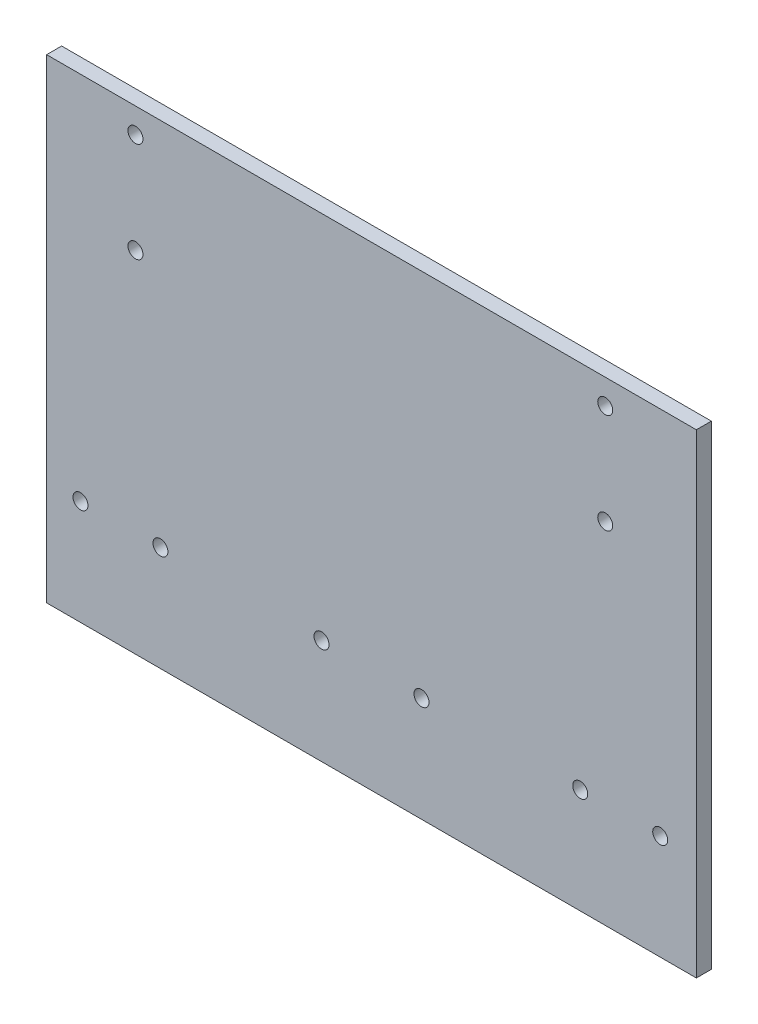
from build123d import *

# Parameters (mm, degrees)
SKETCH_1_W          = 130
SKETCH_1_H          = 95
EXTRUDE_1_DEPTH     = 3
SKETCH_2_R          = 1.5
CUT_EXTRUDE_1_DEPTH = 10
SKETCH_3_R          = 1.5
CUT_EXTRUDE_2_DEPTH = 10
SKETCH_4_R          = 1.5
CUT_EXTRUDE_3_DEPTH = 10


with BuildPart() as part:
    # 草图1 → 凸台-拉伸1 (new body)
    with BuildSketch(Plane.XY):
        Rectangle(SKETCH_1_W, SKETCH_1_H)
    extrude(amount=EXTRUDE_1_DEPTH)

    # 草图2 → 切除-拉伸1 (cut)
    with BuildSketch(Plane.XY.offset(3)):
        with Locations((10, -26.5)):
            Circle(SKETCH_2_R)
        with Locations((-10, -26.5)):
            Circle(SKETCH_2_R)
    extrude(amount=-CUT_EXTRUDE_1_DEPTH, mode=Mode.SUBTRACT)

    # 草图3 → 切除-拉伸2 (cut)
    with BuildSketch(Plane(origin=(0, 0, 0), x_dir=(-1, 0, 0), z_dir=(0, 0, -1))):
        with Locations((-57.767112616, -26.5)):
            Circle(SKETCH_3_R)
        with Locations((-41.767112616, -26.5)):
            Circle(SKETCH_3_R)
        with Locations((42.232887384, -26.5)):
            Circle(SKETCH_3_R)
        with Locations((58.232887384, -26.5)):
            Circle(SKETCH_3_R)
    extrude(amount=-CUT_EXTRUDE_2_DEPTH, mode=Mode.SUBTRACT)

    # 草图4 → 切除-拉伸3 (cut)
    with BuildSketch(Plane(origin=(0, 0, 0), x_dir=(-1, 0, 0), z_dir=(0, 0, -1))):
        with Locations((-46.767112616, 42.5)):
            Circle(SKETCH_4_R)
        with Locations((-46.767112616, 22.5)):
            Circle(SKETCH_4_R)
        with Locations((47.232887384, 42.5)):
            Circle(SKETCH_4_R)
        with Locations((47.232887384, 22.5)):
            Circle(SKETCH_4_R)
    extrude(amount=-CUT_EXTRUDE_3_DEPTH, mode=Mode.SUBTRACT)


solid = part.part
